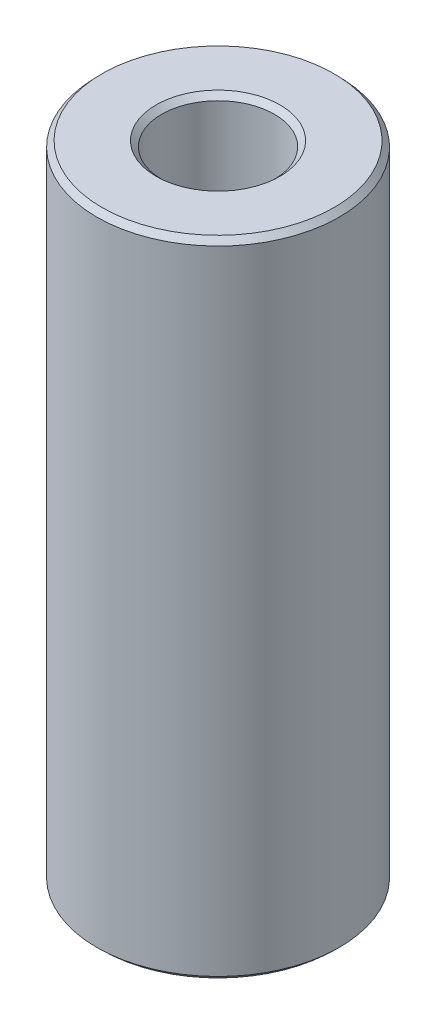
from build123d import *
from OCP.BRepFilletAPI import BRepFilletAPI_MakeChamfer

# Parameters (mm, degrees)
SKETCH1_R           = 60
BOSS_EXTRUDE1_DEPTH = 318.387145912
SKETCH2_R           = 27.879668938
CUT_EXTRUDE1_DEPTH  = 330.500189199
CHAMFER1_SIZE       = 2.777519245
CHAMFER1_SIZE2      = 2.616982634


with BuildPart() as part:
    # Sketch1 → Boss-Extrude1 (new body)
    with BuildSketch(Plane(origin=(0, 0, 0), x_dir=(1, 0, 0), z_dir=(0, 1, 0))):
        Circle(SKETCH1_R)
    extrude(amount=BOSS_EXTRUDE1_DEPTH)

    # Sketch2 → Cut-Extrude1 (cut, through all)
    with BuildSketch(Plane(origin=(0, 0, 0), x_dir=(1, 0, 0), z_dir=(0, 1, 0))):
        Circle(SKETCH2_R)
    extrude(amount=CUT_EXTRUDE1_DEPTH, mode=Mode.SUBTRACT)

    # Chamfer1: one chamfer whose edges measure the first distance from different faces: ONE call of the kernel's chamfer builder (chamfer() names one face for all edges)
    chamfer1_edges_1 = [part.edges().sort_by_distance(p)[0] for p in [
        (-27.879668938, 318.387145912, 0),
    ]]
    chamfer1_side_1 = [part.faces().sort_by_distance(p)[0] for p in [
        (-58.302943725, 318.387145912, 0),
    ]]
    chamfer1_edges_2 = [part.edges().sort_by_distance(p)[0] for p in [
        (-27.879668938, 0, 0),
    ]]
    chamfer1_side_2 = [part.faces().sort_by_distance(p)[0] for p in [
        (-27.879668938, 159.193572956, 0),
    ]]
    chamfer1_edges_3 = [part.edges().sort_by_distance(p)[0] for p in [
        (-60, 0, 0),
    ]]
    chamfer1_side_3 = [part.faces().sort_by_distance(p)[0] for p in [
        (-58.302943725, 0, 0),
    ]]
    chamfer1_edges_4 = [part.edges().sort_by_distance(p)[0] for p in [
        (-60, 318.387145912, 0),
    ]]
    chamfer1_side_4 = [part.faces().sort_by_distance(p)[0] for p in [
        (-60, 159.193572956, 0),
    ]]
    chamfer1 = BRepFilletAPI_MakeChamfer(part.part.solid().wrapped)
    for e in chamfer1_edges_1:
        chamfer1.Add(CHAMFER1_SIZE, CHAMFER1_SIZE2, e.wrapped, chamfer1_side_1[0].wrapped)  # the first distance lies on this face
    for e in chamfer1_edges_2:
        chamfer1.Add(CHAMFER1_SIZE, CHAMFER1_SIZE2, e.wrapped, chamfer1_side_2[0].wrapped)  # the first distance lies on this face
    for e in chamfer1_edges_3:
        chamfer1.Add(CHAMFER1_SIZE, CHAMFER1_SIZE2, e.wrapped, chamfer1_side_3[0].wrapped)  # the first distance lies on this face
    for e in chamfer1_edges_4:
        chamfer1.Add(CHAMFER1_SIZE, CHAMFER1_SIZE2, e.wrapped, chamfer1_side_4[0].wrapped)  # the first distance lies on this face
    add(Compound.cast(chamfer1.Shape()), mode=Mode.REPLACE)


solid = part.part
